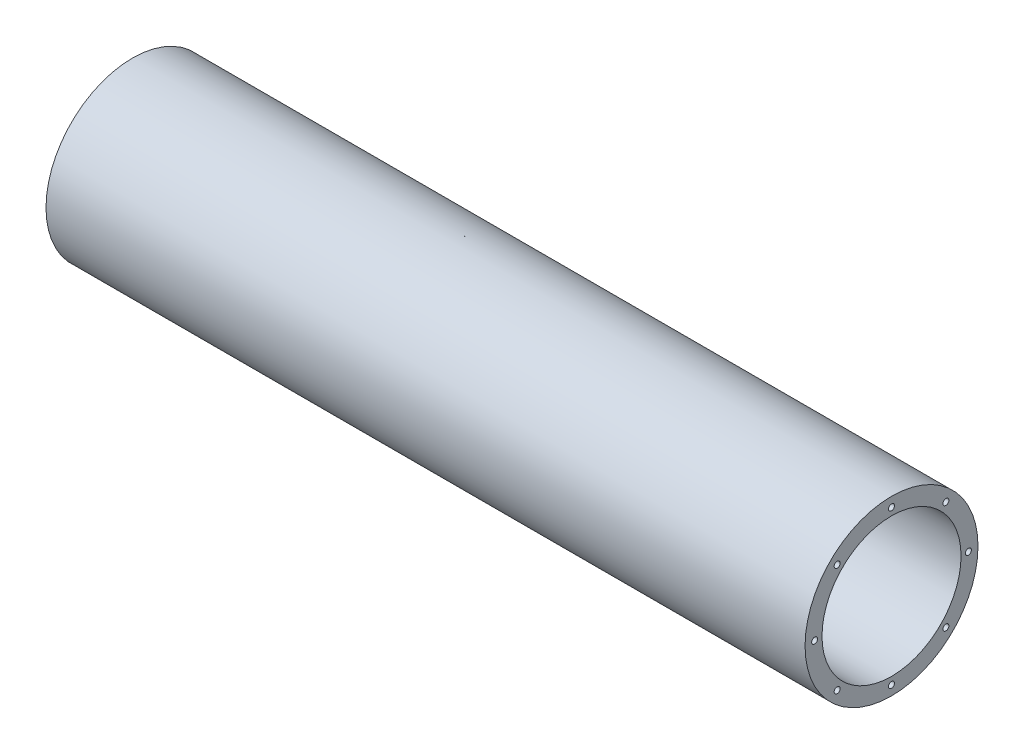
from build123d import *

# Parameters (mm, degrees)
SKETCH1_R           = 57.15
SKETCH1_R_2         = 45.9486
BOSS_EXTRUDE1_DEPTH = 501.65
SKETCH2_R           = 45.9486
SKETCH2_R_2         = 44.5262
BOSS_EXTRUDE2_DEPTH = 76.2
SKETCH3_R           = 1.984375
CUT_EXTRUDE1_DEPTH  = 13.97
CUT_EXTRUDE2_START  = -13.97
SKETCH4_R           = 1.984375
CUT_EXTRUDE2_DEPTH  = 13.97


with BuildPart() as part:
    # Sketch1 → Boss-Extrude1 (new body)
    with BuildSketch(Plane(origin=(0, 0, 0), x_dir=(0, 0, -1), z_dir=(1, 0, 0))):
        Circle(SKETCH1_R)
        Circle(SKETCH1_R_2, mode=Mode.SUBTRACT)
    extrude(amount=BOSS_EXTRUDE1_DEPTH)

    # Sketch2 → Boss-Extrude2 (add)
    with BuildSketch(Plane.ZY):
        Circle(SKETCH2_R)
        Circle(SKETCH2_R_2, mode=Mode.SUBTRACT)
    extrude(amount=-BOSS_EXTRUDE2_DEPTH)

    # Sketch3 → Cut-Extrude1 (cut)
    with BuildSketch(Plane.ZY):
        with Locations((0, 50.8)):
            Circle(SKETCH3_R)
        with Locations((35.921024484, 35.921024484)):
            Circle(SKETCH3_R)
        with Locations((50.8, 0)):
            Circle(SKETCH3_R)
        with Locations((35.921024484, -35.921024484)):
            Circle(SKETCH3_R)
        with Locations((0, -50.8)):
            Circle(SKETCH3_R)
        with Locations((-35.921024484, -35.921024484)):
            Circle(SKETCH3_R)
        with Locations((-50.8, 0)):
            Circle(SKETCH3_R)
        with Locations((-35.921024484, 35.921024484)):
            Circle(SKETCH3_R)
    extrude(amount=-CUT_EXTRUDE1_DEPTH, mode=Mode.SUBTRACT)

    # Sketch4 → Cut-Extrude2 (cut)
    with BuildSketch(Plane(origin=(501.65, 0, 0), x_dir=(0, 0, -1), z_dir=(1, 0, 0)).offset(CUT_EXTRUDE2_START)):
        with Locations((0, 50.8)):
            Circle(SKETCH4_R)
        with Locations((35.921024484, 35.921024484)):
            Circle(SKETCH4_R)
        with Locations((50.8, 0)):
            Circle(SKETCH4_R)
        with Locations((35.921024484, -35.921024484)):
            Circle(SKETCH4_R)
        with Locations((0, -50.8)):
            Circle(SKETCH4_R)
        with Locations((-35.921024484, -35.921024484)):
            Circle(SKETCH4_R)
        with Locations((-50.8, 0)):
            Circle(SKETCH4_R)
        with Locations((-35.921024484, 35.921024484)):
            Circle(SKETCH4_R)
    extrude(amount=CUT_EXTRUDE2_DEPTH, mode=Mode.SUBTRACT)


solid = part.part
